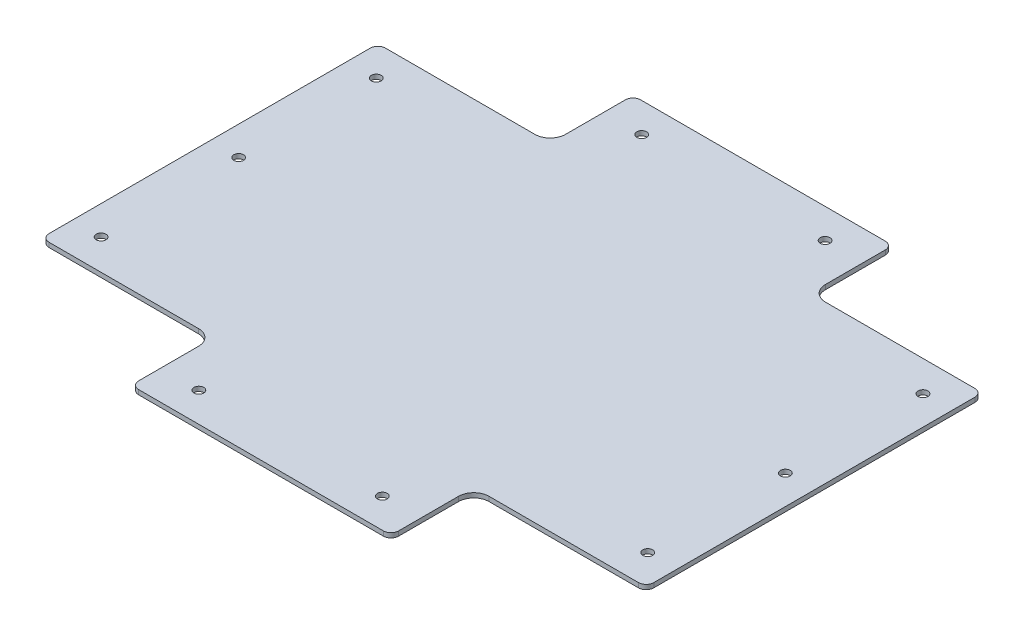
from build123d import *

# Parameters (mm, degrees)
SKETCH_1_R      = 3.2
EXTRUDE_1_DEPTH = 3


with BuildPart() as part:
    # Эскиз1 → Бобышка-Вытянуть1 (new body)
    with BuildSketch(Plane(origin=(0, 0, 0), x_dir=(1, 0, 0), z_dir=(0, 1, 0))):
        with BuildLine():
            ThreePointArc((-85, -159.126343601), (-83.535533906, -162.661877507), (-80, -164.126343601))
            Line((-80, -164.126343601), (80, -164.126343601))
            ThreePointArc((80, -164.126343601), (83.535533906, -162.661877507), (85, -159.126343601))
            Line((85, -159.126343601), (85, -120))
            ThreePointArc((85, -120), (87.928932188, -112.928932188), (95, -110))
            Line((95, -110), (192.717843923, -110))
            ThreePointArc((192.717843923, -110), (196.253377829, -108.535533906), (197.717843923, -105))
            Line((197.717843923, -105), (197.717843923, 105))
            ThreePointArc((197.717843923, 105), (196.253377829, 108.535533906), (192.717843923, 110))
            Line((192.717843923, 110), (95, 110))
            ThreePointArc((95, 110), (87.928932188, 112.928932188), (85, 120))
            Line((85, 120), (85, 159.126343601))
            ThreePointArc((85, 159.126343601), (83.535533906, 162.661877507), (80, 164.126343601))
            Line((80, 164.126343601), (-80, 164.126343601))
            ThreePointArc((-80, 164.126343601), (-83.535533906, 162.661877507), (-85, 159.126343601))
            Line((-85, 159.126343601), (-85, 120))
            ThreePointArc((-85, 120), (-87.928932188, 112.928932188), (-95, 110))
            Line((-95, 110), (-192.717843923, 110))
            ThreePointArc((-192.717843923, 110), (-196.253377829, 108.535533906), (-197.717843923, 105))
            Line((-197.717843923, 105), (-197.717843923, -105))
            ThreePointArc((-197.717843923, -105), (-196.253377829, -108.535533906), (-192.717843923, -110))
            Line((-192.717843923, -110), (-95, -110))
            ThreePointArc((-95, -110), (-87.928932188, -112.928932188), (-85, -120))
            Line((-85, -120), (-85, -159.126343601))
        make_face()
        with Locations((-60, -144.805454142)):
            Circle(SKETCH_1_R, mode=Mode.SUBTRACT)
        with Locations((60, -144.805454142)):
            Circle(SKETCH_1_R, mode=Mode.SUBTRACT)
        with Locations((-60, 144.805454142)):
            Circle(SKETCH_1_R, mode=Mode.SUBTRACT)
        with Locations((60, 144.805454142)):
            Circle(SKETCH_1_R, mode=Mode.SUBTRACT)
        with Locations((-178.768667216, 0)):
            Circle(SKETCH_1_R, mode=Mode.SUBTRACT)
        with Locations((-178.768667216, 90)):
            Circle(SKETCH_1_R, mode=Mode.SUBTRACT)
        with Locations((-178.768667216, -90)):
            Circle(SKETCH_1_R, mode=Mode.SUBTRACT)
        with Locations((178.768667216, 0)):
            Circle(SKETCH_1_R, mode=Mode.SUBTRACT)
        with Locations((178.768667216, 90)):
            Circle(SKETCH_1_R, mode=Mode.SUBTRACT)
        with Locations((178.768667216, -90)):
            Circle(SKETCH_1_R, mode=Mode.SUBTRACT)
    extrude(amount=EXTRUDE_1_DEPTH)


solid = part.part
